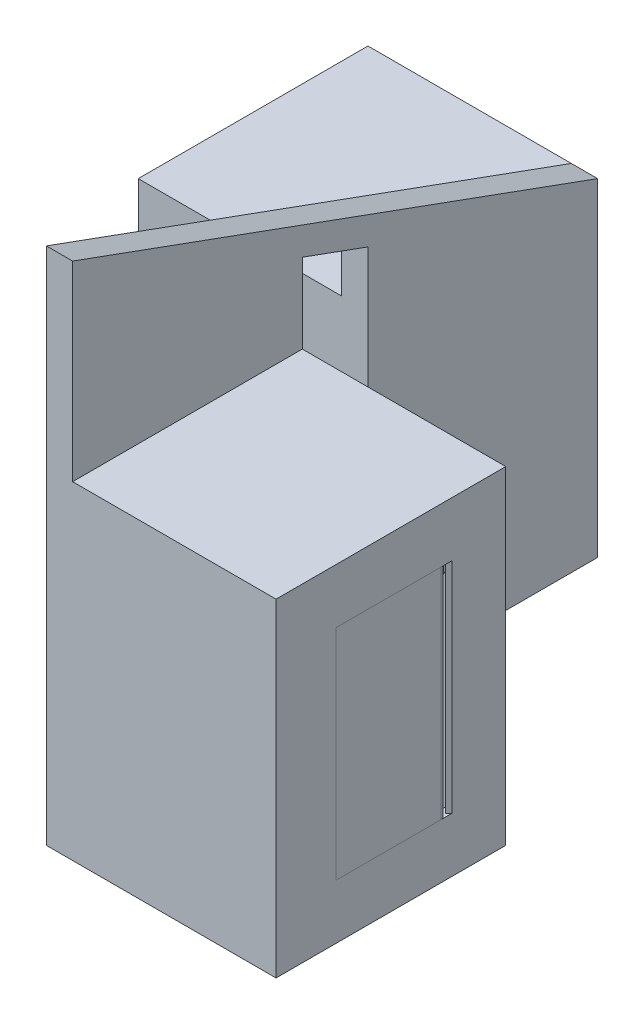
from build123d import *

# Parameters (mm, degrees)
SKETCH1_W              = 210
SKETCH1_H              = 300
SKETCH1_W_2            = 100
SKETCH1_H_2            = 200
BOSS_EXTRUDE1_DEPTH    = 12
BOSS_EXTRUDE2_START    = -12
SKETCH1_3_W            = 210
SKETCH1_3_H            = 300
SKETCH1_3_W_2          = 100
SKETCH1_3_H_2          = 200
BOSS_EXTRUDE2_DEPTH    = 210
BOSS_EXTRUDE3_START    = 12
SKETCH1_4_W            = 210
SKETCH1_4_H            = 300
SKETCH1_4_W_2          = 100
SKETCH1_4_H_2          = 200
BOSS_EXTRUDE3_DEPTH    = 210
SHELL1_START           = -190
SHELL1_OUTLINE_W       = 284
SHELL1_OUTLINE_H       = 194
SHELL1_DEPTH           = 194
SHELL1_START_2         = -4
SHELL1_2_OUTLINE_W     = 284
SHELL1_2_OUTLINE_H     = 194
SHELL1_2_DEPTH         = 194
SHELL1_3_DEPTH         = 8
CUT_EXTRUDE1_START     = 198
SKETCH1_5_W            = 100
SKETCH1_5_H            = 200
CUT_EXTRUDE1_DEPTH     = 8
CUT_EXTRUDE2_START     = -198
SKETCH1_6_W            = 100
SKETCH1_6_H            = 200
CUT_EXTRUDE2_DEPTH     = 8
CUT_EXTRUDE6_START     = 42
CUT_EXTRUDE6_DEPTH     = 200
BOSS_EXTRUDE4_START    = 42
BOSS_EXTRUDE4_DEPTH    = 200
BOSS_EXTRUDE5_START    = 42
BOSS_EXTRUDE5_DEPTH    = 8
BOSS_EXTRUDE6_START    = 42
SKETCH5_6_R            = 2
BOSS_EXTRUDE6_DEPTH    = 8
BOSS_EXTRUDE7_START    = 242
SKETCH5_7_R            = 2
BOSS_EXTRUDE7_DEPTH    = 8
INDENT1_START          = -330.731696712
INDENT1_OUTLINE_R      = 2
INDENT1_DEPTH          = 216
BOSS_EXTRUDE8_START    = 42
SKETCH6_R              = 2
BOSS_EXTRUDE8_DEPTH    = 8
BOSS_EXTRUDE9_START    = 42
SKETCH6_4_R            = 2
BOSS_EXTRUDE9_DEPTH    = 8
SKETCH7_W              = 2
SKETCH7_H              = 2
SKETCH7_H_2            = 8
SKETCH7_W_2            = 68.326220251
BOSS_EXTRUDE10_DEPTH   = 8
CUT_EXTRUDE7_DEPTH     = 4
BOSS_EXTRUDE11_START   = -4
BOSS_EXTRUDE11_DEPTH   = 46
SKETCH8_3_R            = 2
BOSS_EXTRUDE11_2_DEPTH = 46
BOSS_EXTRUDE12_DEPTH   = 8
BOSS_EXTRUDE13_DEPTH   = 8
SKETCH11_R             = 2
BOSS_EXTRUDE14_DEPTH   = 8
SKETCH14_W             = 4
SKETCH14_H             = 4
BOSS_EXTRUDE15_DEPTH   = 8
BOSS_EXTRUDE16_DEPTH   = 8
SKETCH13_W             = 4
SKETCH13_H             = 4
CUT_EXTRUDE8_DEPTH     = 12
SKETCH14_4_W           = 4
SKETCH14_4_H           = 4
BOSS_EXTRUDE17_DEPTH   = 12
CUT_EXTRUDE9_DEPTH     = 4
CUT_EXTRUDE10_DEPTH    = 100
SKETCH12_3_R           = 4
SKETCH12_3_R_2         = 2
BOSS_EXTRUDE18_DEPTH   = 100
SKETCH12_4_R           = 2
BOSS_EXTRUDE19_DEPTH   = 8
BOSS_EXTRUDE20_START   = 100
SKETCH12_5_R           = 2
BOSS_EXTRUDE20_DEPTH   = 8
BOSS_EXTRUDE21_DEPTH   = 8
BOSS_EXTRUDE22_DEPTH   = 8
BOSS_EXTRUDE23_DEPTH   = 8
BOSS_EXTRUDE24_START   = 8
BOSS_EXTRUDE24_DEPTH   = 8
CUT_EXTRUDE11_START    = 8
CUT_EXTRUDE11_DEPTH    = 8
BOSS_EXTRUDE25_START   = -4
BOSS_EXTRUDE25_DEPTH   = 28
INDENT2_START          = -223
INDENT2_OUTLINE_R      = 2
INDENT2_DEPTH          = 116
SKETCH19_W             = 30
SKETCH19_H             = 10
BOSS_EXTRUDE26_DEPTH   = 34


# Read off the part's stored shape, not the designer's step: Shell1, Indent1, Cut-Extrude10, Indent2
with BuildPart() as part:
    # Sketch1 → Boss-Extrude1 (new, symmetric)
    # profile 1 of 5: a face of its own
    with BuildSketch(Plane(origin=(0, 0, 0), x_dir=(0, 0, -1), z_dir=(1, 0, 0))):
        Polygon((270, -72.731696712), (-210, 101.974015735), (-210, -72.731696712), (0, -72.731696712), (0, 0), (60, -21.838214056), (60, -72.731696712), align=None)
    # profile 2 of 5: a face of its own
    with BuildSketch(Plane(origin=(0, 0, 0), x_dir=(0, 0, -1), z_dir=(1, 0, 0))):
        with Locations((-105, -222.731696712)):
            Rectangle(SKETCH1_W, SKETCH1_H)
        with Locations((-105, -222.731696712)):
            Rectangle(SKETCH1_W_2, SKETCH1_H_2, mode=Mode.SUBTRACT)
    # profile 3 of 5: a face of its own
    with BuildSketch(Plane(origin=(0, 0, 0), x_dir=(0, 0, -1), z_dir=(1, 0, 0))):
        with Locations((-105, -222.731696712)):
            Rectangle(SKETCH1_W_2, SKETCH1_H_2)
    # profile 4 of 5: a face of its own
    with BuildSketch(Plane(origin=(0, 0, 0), x_dir=(0, 0, -1), z_dir=(1, 0, 0))):
        with Locations((165, -222.731696712)):
            Rectangle(SKETCH1_W, SKETCH1_H)
        with Locations((165, -222.731696712)):
            Rectangle(SKETCH1_W_2, SKETCH1_H_2, mode=Mode.SUBTRACT)
    # profile 5 of 5: a face of its own
    with BuildSketch(Plane(origin=(0, 0, 0), x_dir=(0, 0, -1), z_dir=(1, 0, 0))):
        with Locations((165, -222.731696712)):
            Rectangle(SKETCH1_W_2, SKETCH1_H_2)
    extrude(amount=BOSS_EXTRUDE1_DEPTH, both=True)

    # Sketch1<3> → Boss-Extrude2 (add)
    # profile 1 of 2: a face of its own
    with BuildSketch(Plane(origin=(0, 0, 0), x_dir=(0, 0, -1), z_dir=(1, 0, 0)).offset(BOSS_EXTRUDE2_START)):
        with Locations((-105, -222.731696712)):
            Rectangle(SKETCH1_3_W, SKETCH1_3_H)
        with Locations((-105, -222.731696712)):
            Rectangle(SKETCH1_3_W_2, SKETCH1_3_H_2, mode=Mode.SUBTRACT)
    # profile 2 of 2: a face of its own
    with BuildSketch(Plane(origin=(0, 0, 0), x_dir=(0, 0, -1), z_dir=(1, 0, 0)).offset(BOSS_EXTRUDE2_START)):
        with Locations((-105, -222.731696712)):
            Rectangle(SKETCH1_3_W_2, SKETCH1_3_H_2)
    extrude(amount=BOSS_EXTRUDE2_DEPTH)

    # Sketch1<4> → Boss-Extrude3 (add)
    # profile 1 of 2: a face of its own
    with BuildSketch(Plane(origin=(0, 0, 0), x_dir=(0, 0, -1), z_dir=(1, 0, 0)).offset(BOSS_EXTRUDE3_START)):
        with Locations((165, -222.731696712)):
            Rectangle(SKETCH1_4_W, SKETCH1_4_H)
        with Locations((165, -222.731696712)):
            Rectangle(SKETCH1_4_W_2, SKETCH1_4_H_2, mode=Mode.SUBTRACT)
    # profile 2 of 2: a face of its own
    with BuildSketch(Plane(origin=(0, 0, 0), x_dir=(0, 0, -1), z_dir=(1, 0, 0)).offset(BOSS_EXTRUDE3_START)):
        with Locations((165, -222.731696712)):
            Rectangle(SKETCH1_4_W_2, SKETCH1_4_H_2)
    extrude(amount=-BOSS_EXTRUDE3_DEPTH)

    # Shell1 outline → Shell1 (cut)
    with BuildSketch(Plane.YZ.offset(SHELL1_START)):
        with Locations((-222.731696712, -165)):
            Rectangle(SHELL1_OUTLINE_W, SHELL1_OUTLINE_H)
    extrude(amount=SHELL1_DEPTH, mode=Mode.SUBTRACT)

    # Shell1 2 outline → Shell1 2 (cut)
    with BuildSketch(Plane.YZ.offset(SHELL1_START_2)):
        with Locations((-222.731696712, 105)):
            Rectangle(SHELL1_2_OUTLINE_W, SHELL1_2_OUTLINE_H)
    extrude(amount=SHELL1_2_DEPTH, mode=Mode.SUBTRACT)

    # Shell1 3 outline → Shell1 3 (cut)
    with BuildSketch(Plane.YZ.offset(SHELL1_START_2)):
        Polygon((90.548831681, 202), (-80.731696712, 202), (-80.731696712, 8), (11.425184054, 8), (-16.23655375, -68), (-80.731696712, -68), (-80.731696712, -262), (-78.333357018, -262), align=None)
    extrude(amount=SHELL1_3_DEPTH, mode=Mode.SUBTRACT)

    # Sketch1<5> → Cut-Extrude1 (cut)
    with BuildSketch(Plane(origin=(0, 0, 0), x_dir=(0, 0, -1), z_dir=(1, 0, 0)).offset(CUT_EXTRUDE1_START)):
        with Locations((-105, -222.731696712)):
            Rectangle(SKETCH1_5_W, SKETCH1_5_H)
    extrude(amount=-CUT_EXTRUDE1_DEPTH, mode=Mode.SUBTRACT)

    # Sketch1<6> → Cut-Extrude2 (cut)
    with BuildSketch(Plane(origin=(0, 0, 0), x_dir=(0, 0, -1), z_dir=(1, 0, 0)).offset(CUT_EXTRUDE2_START)):
        with Locations((165, -222.731696712)):
            Rectangle(SKETCH1_6_W, SKETCH1_6_H)
    extrude(amount=CUT_EXTRUDE2_DEPTH, mode=Mode.SUBTRACT)

    # Sketch5 → Cut-Extrude6 (cut)
    with BuildSketch(Plane.XZ.offset(80.731696712).offset(CUT_EXTRUDE6_START)):
        Polygon((261.882250994, -8.882250994), (198, 55), (196.522319509, 55), (195.171438948, 52.171706803), (259.053823869, -11.710678119), align=None)
        Polygon((192.343145751, 55), (190, 55), (190, 41.344439007), (195.171438948, 52.171706803), align=None)
        Polygon((194, 55), (192.343145751, 55), (195.171438948, 52.171706803), (196.522319509, 55), align=None)
    extrude(amount=CUT_EXTRUDE6_DEPTH, mode=Mode.SUBTRACT)

    # Indent1 outline → Indent1 (cut)
    with BuildSketch(Plane(origin=(0, 0, 0), x_dir=(1, 0, 0), z_dir=(0, 1, 0)).offset(INDENT1_START)):
        with Locations((194, -59)):
            Circle(INDENT1_OUTLINE_R)
    extrude(amount=INDENT1_DEPTH, mode=Mode.SUBTRACT)

    # Sketch8 → Cut-Extrude7 (cut)
    with BuildSketch(Plane.XZ.offset(80.731696712)):
        with BuildLine():
            ThreePointArc((116.073911699, 24.973088192), (116.008634179, 24.466285543), (115.817062773, 23.992565713))
            Line((115.817062773, 23.992565713), (160.817062773, 103.992565713))
            ThreePointArc((160.817062773, 103.992565713), (160.054434178, 106.716239267), (157.330760624, 105.953610672))
            Line((157.330760624, 105.953610672), (112.330760624, 25.953610672))
            ThreePointArc((112.330760624, 25.953610672), (114.580714348, 26.907810672), (116.073911699, 24.973088192))
        make_face()
        with BuildLine():
            ThreePointArc((112.330760624, 25.953610672), (113.093389219, 23.229937118), (115.817062773, 23.992565713))
            ThreePointArc((115.817062773, 23.992565713), (116.008634179, 24.466285543), (116.073911699, 24.973088192))
            ThreePointArc((116.073911699, 24.973088192), (114.580714348, 26.907810672), (112.330760624, 25.953610672))
        make_face()
        with BuildLine():
            ThreePointArc((84.58145395, 127.540956313), (83.546011614, 130.17303898), (80.913928946, 129.137596645))
            Line((80.913928946, 129.137596645), (35.913928946, 25.771408358))
            ThreePointArc((35.913928946, 25.771408358), (38.155413778, 26.93108781), (39.747691448, 24.973088192))
            ThreePointArc((39.747691448, 24.973088192), (39.705691065, 24.565365862), (39.58145395, 24.174768026))
            Line((39.58145395, 24.174768026), (84.58145395, 127.540956313))
        make_face()
        with BuildLine():
            ThreePointArc((39.747691448, 24.973088192), (38.155413778, 26.93108781), (35.913928946, 25.771408358))
            ThreePointArc((35.913928946, 25.771408358), (36.949371282, 23.139325691), (39.58145395, 24.174768026))
            ThreePointArc((39.58145395, 24.174768026), (39.705691065, 24.565365862), (39.747691448, 24.973088192))
        make_face()
    extrude(amount=-CUT_EXTRUDE7_DEPTH, mode=Mode.SUBTRACT)

    # Sketch13 → Cut-Extrude8 (cut)
    with BuildSketch(Plane.ZY.offset(4)):
        with BuildLine():
            Line((-232.412295169, -181.443240015), (-129.046106882, -181.443240015))
            ThreePointArc((-129.046106882, -181.443240015), (-127.046106882, -179.443240015), (-129.046106882, -177.443240015))
            Line((-129.046106882, -177.443240015), (-232.412295169, -177.443240015))
            ThreePointArc((-232.412295169, -177.443240015), (-234.412295169, -179.443240015), (-232.412295169, -181.443240015))
        make_face()
        with Locations((-232.412295169, -179.443240015)):
            Rectangle(SKETCH13_W, SKETCH13_H)
        with Locations((-129.046106882, -179.443240015)):
            Rectangle(SKETCH13_W, SKETCH13_H)
    extrude(amount=-CUT_EXTRUDE8_DEPTH, mode=Mode.SUBTRACT)

    # Sketch15 → Cut-Extrude9 (cut)
    with BuildSketch(Plane.ZY.offset(-4)):
        with BuildLine():
            Line((-233.555419875, -191.084357288), (-130.189231589, -263.084357288))
            ThreePointArc((-130.189231589, -263.084357288), (-127.404989609, -262.586364722), (-127.902982175, -259.802122742))
            Line((-127.902982175, -259.802122742), (-231.269170462, -187.802122742))
            ThreePointArc((-231.269170462, -187.802122742), (-234.053412442, -188.300115308), (-233.555419875, -191.084357288))
        make_face()
    extrude(amount=-CUT_EXTRUDE9_DEPTH, mode=Mode.SUBTRACT)

    # Cut-Extrude10 outline → Cut-Extrude10 (cut)
    with BuildSketch(Plane.XY.offset(-215)):
        Polygon((-190, -122.731696712), (-190, -106.622338744), (-195.404613209, -119.670229254), (-198, -117.074842463), (-198, -122.731696712), align=None)
    extrude(amount=CUT_EXTRUDE10_DEPTH, mode=Mode.SUBTRACT)

    # Indent2 outline → Indent2 (cut)
    with BuildSketch(Plane.XY.offset(INDENT2_START)):
        with Locations((-194, -126.731696712)):
            Circle(INDENT2_OUTLINE_R)
    extrude(amount=INDENT2_DEPTH, mode=Mode.SUBTRACT)

    # Sketch19 → Boss-Extrude26 (add)
    with BuildSketch(Plane.XZ.offset(80.731696712)):
        with Locations((95.073911699, 73.973088192)):
            Rectangle(SKETCH19_W, SKETCH19_H)
        with Locations((95.073911699, 55.973088192)):
            Rectangle(SKETCH19_W, SKETCH19_H)
    extrude(amount=BOSS_EXTRUDE26_DEPTH)


with BuildPart() as body_2:
    # Sketch5<4> → Boss-Extrude4 (new body)
    with BuildSketch(Plane.XZ.offset(80.731696712).offset(BOSS_EXTRUDE4_START)):
        with BuildLine():
            Line((190, 155), (190, 70.314845037))
            Line((190, 70.314845037), (192.666785717, 62.771278255))
            ThreePointArc((192.666785717, 62.771278255), (194.883831106, 62.901133499), (196.828427125, 61.828427125))
            Line((196.828427125, 61.828427125), (198, 60.656854249))
            Line((198, 60.656854249), (198, 155))
            Line((198, 155), (190, 155))
        make_face()
        with BuildLine():
            Line((192.666785717, 62.771278255), (190, 70.314845037))
            Line((190, 70.314845037), (190, 59.906230054))
            Line((190, 59.906230054), (190.390578712, 60.723971567))
            ThreePointArc((190.390578712, 60.723971567), (191.325064904, 61.974007773), (192.666785717, 62.771278255))
        make_face()
        with BuildLine():
            ThreePointArc((196.828427125, 61.828427125), (194.883831106, 62.901133499), (192.666785717, 62.771278255))
            Line((192.666785717, 62.771278255), (193.333392858, 60.885639127))
            ThreePointArc((193.333392858, 60.885639127), (195.154726313, 60.632974936), (196, 59))
            ThreePointArc((196, 59), (195.847759065, 58.234633135), (195.414213562, 57.585786438))
            Line((195.414213562, 57.585786438), (196.828427125, 56.171572875))
            ThreePointArc((196.828427125, 56.171572875), (197.265949872, 56.690547374), (197.609421288, 57.276028433))
            ThreePointArc((197.609421288, 57.276028433), (197.901133499, 58.116168894), (198, 59))
            ThreePointArc((198, 59), (197.69551813, 60.530733729), (196.828427125, 61.828427125))
        make_face()
        with BuildLine():
            Line((193.333392858, 60.885639127), (192.666785717, 62.771278255))
            ThreePointArc((192.666785717, 62.771278255), (191.325064904, 61.974007773), (190.390578712, 60.723971567))
            ThreePointArc((190.390578712, 60.723971567), (190.098866501, 59.883831106), (190, 59))
            ThreePointArc((190, 59), (190.30448187, 57.469266271), (191.171572875, 56.171572875))
            ThreePointArc((191.171572875, 56.171572875), (192.469266271, 55.30448187), (194, 55))
            ThreePointArc((194, 55), (195.530733729, 55.30448187), (196.828427125, 56.171572875))
            Line((196.828427125, 56.171572875), (195.414213562, 57.585786438))
            ThreePointArc((195.414213562, 57.585786438), (192.30825954, 57.933222508), (193.333392858, 60.885639127))
        make_face()
        with BuildLine():
            Line((198, 60.656854249), (196.828427125, 61.828427125))
            ThreePointArc((196.828427125, 61.828427125), (197.69551813, 60.530733729), (198, 59))
            Line((198, 59), (198, 60.656854249))
        make_face()
        with BuildLine():
            ThreePointArc((196, 59), (195.154726313, 60.632974936), (193.333392858, 60.885639127))
            Line((193.333392858, 60.885639127), (194, 59))
            Line((194, 59), (195.414213562, 57.585786438))
            ThreePointArc((195.414213562, 57.585786438), (195.847759065, 58.234633135), (196, 59))
        make_face()
        with BuildLine():
            Line((194, 59), (193.333392858, 60.885639127))
            ThreePointArc((193.333392858, 60.885639127), (192.30825954, 57.933222508), (195.414213562, 57.585786438))
            Line((195.414213562, 57.585786438), (194, 59))
        make_face()
        with BuildLine():
            Line((190.390578712, 60.723971567), (190, 59.906230054))
            Line((190, 59.906230054), (190, 59))
            ThreePointArc((190, 59), (190.098866501, 59.883831106), (190.390578712, 60.723971567))
        make_face()
    extrude(amount=BOSS_EXTRUDE4_DEPTH)

    # Sketch5<5> → Boss-Extrude5 (add)
    with BuildSketch(Plane.XZ.offset(80.731696712).offset(BOSS_EXTRUDE5_START)):
        with BuildLine():
            Line((183.601414115, 46.509725989), (169.374813886, 16.723971567))
            ThreePointArc((169.374813886, 16.723971567), (171.260263607, 11.390578712), (176.593656463, 13.276028433))
            Line((176.593656463, 13.276028433), (196.999966519, 56.000033481))
            Line((196.999966519, 56.000033481), (196.828427125, 56.171572875))
            ThreePointArc((196.828427125, 56.171572875), (195.530733729, 55.30448187), (194, 55))
            Line((194, 55), (192.343145751, 55))
            Line((192.343145751, 55), (191.171572875, 56.171572875))
            ThreePointArc((191.171572875, 56.171572875), (190.30448187, 57.469266271), (190, 59))
            Line((190, 59), (190, 59.906230054))
            Line((190, 59.906230054), (183.601414115, 46.509725989))
        make_face()
        with BuildLine():
            Line((171.17952453, 15.861985784), (175.942980804, 25.835073976))
            ThreePointArc((175.942980804, 25.835073976), (178.609677231, 26.777798836), (179.552402092, 24.111102409))
            Line((179.552402092, 24.111102409), (174.788945818, 14.138014216))
            ThreePointArc((174.788945818, 14.138014216), (172.122249391, 13.195289356), (171.17952453, 15.861985784))
        make_face(mode=Mode.SUBTRACT)
    extrude(amount=BOSS_EXTRUDE5_DEPTH)

    # Sketch5<6> → Boss-Extrude6 (add)
    with BuildSketch(Plane.XZ.offset(80.731696712).offset(BOSS_EXTRUDE6_START)):
        with Locations(Location((194, 59, 0), (0, 0, 90))):
            Circle(SKETCH5_6_R)
    extrude(amount=-BOSS_EXTRUDE6_DEPTH)

    # Sketch5<7> → Boss-Extrude7 (add)
    with BuildSketch(Plane.XZ.offset(80.731696712).offset(BOSS_EXTRUDE7_START)):
        with Locations(Location((194, 59, 0), (0, 0, 90))):
            Circle(SKETCH5_7_R)
    extrude(amount=BOSS_EXTRUDE7_DEPTH)


with BuildPart() as body_3:
    # Sketch6 → Boss-Extrude8 (new body)
    # profile 1 of 2: a face of its own
    with BuildSketch(Plane.XZ.offset(80.731696712).offset(BOSS_EXTRUDE8_START)):
        with BuildLine():
            Line((159.073911699, 28.973088192), (114.073911699, 28.973088192))
            ThreePointArc((114.073911699, 28.973088192), (110.073911699, 24.973088192), (114.073911699, 20.973088192))
            Line((114.073911699, 20.973088192), (159.073911699, 20.973088192))
            Line((159.073911699, 20.973088192), (177.747691448, 20.973088192))
            ThreePointArc((177.747691448, 20.973088192), (181.747691448, 24.973088192), (177.747691448, 28.973088192))
            Line((177.747691448, 28.973088192), (159.073911699, 28.973088192))
        make_face()
        with Locations((177.747691448, 24.973088192)):
            Circle(SKETCH6_R, mode=Mode.SUBTRACT)
        with BuildLine():
            ThreePointArc((114.073911699, 26.973088192), (112.073911699, 24.973088192), (114.073911699, 22.973088192))
            Line((114.073911699, 22.973088192), (159.073911699, 22.973088192))
            ThreePointArc((159.073911699, 22.973088192), (161.073911699, 24.973088192), (159.073911699, 26.973088192))
            Line((159.073911699, 26.973088192), (114.073911699, 26.973088192))
        make_face(mode=Mode.SUBTRACT)
    # profile 2 of 2: a face of its own
    with BuildSketch(Plane.XZ.offset(80.731696712).offset(BOSS_EXTRUDE8_START)):
        with Locations((177.747691448, 24.973088192)):
            Circle(SKETCH6_R)
    extrude(amount=-BOSS_EXTRUDE8_DEPTH)

    # Sketch6<4> → Boss-Extrude9 (add)
    with BuildSketch(Plane.XZ.offset(80.731696712).offset(BOSS_EXTRUDE9_START)):
        with Locations(Location((177.747691448, 24.973088192, 0), (0, 0, 90))):
            Circle(SKETCH6_4_R)
    extrude(amount=BOSS_EXTRUDE9_DEPTH)


with BuildPart() as body_4:
    # Sketch7 → Boss-Extrude10 (new body)
    with BuildSketch(Plane(origin=(0, -114.731696712, 0), x_dir=(1, 0, 0), z_dir=(0, 1, 0))):
        with BuildLine():
            Line((116.073911699, -28.973088192), (116.073911699, -61.508986577))
            ThreePointArc((116.073911699, -61.508986577), (117.538013314, -62.973088192), (118.073911699, -64.973088192))
            Line((118.073911699, -64.973088192), (118.073911699, -28.973088192))
            Line((118.073911699, -28.973088192), (116.073911699, -28.973088192))
        make_face()
        with BuildLine():
            Line((110.073911699, -24.973088192), (110.073911699, -60.973088192))
            Line((110.073911699, -60.973088192), (112.073911699, -60.973088192))
            Line((112.073911699, -60.973088192), (112.073911699, -28.437189807))
            ThreePointArc((112.073911699, -28.437189807), (110.609810083, -26.973088192), (110.073911699, -24.973088192))
        make_face()
        with BuildLine():
            ThreePointArc((114.073911699, -20.973088192), (111.245484574, -22.144661068), (110.073911699, -24.973088192))
            ThreePointArc((110.073911699, -24.973088192), (110.609810083, -26.973088192), (112.073911699, -28.437189807))
            Line((112.073911699, -28.437189807), (112.073911699, -24.973088192))
            ThreePointArc((112.073911699, -24.973088192), (112.659698136, -23.55887463), (114.073911699, -22.973088192))
            Line((114.073911699, -22.973088192), (117.538013314, -22.973088192))
            ThreePointArc((117.538013314, -22.973088192), (116.073911699, -21.508986577), (114.073911699, -20.973088192))
        make_face()
        with BuildLine():
            ThreePointArc((118.073911699, -24.973088192), (117.937615004, -23.937812012), (117.538013314, -22.973088192))
            Line((117.538013314, -22.973088192), (114.073911699, -22.973088192))
            ThreePointArc((114.073911699, -22.973088192), (115.488125261, -23.55887463), (116.073911699, -24.973088192))
            Line((116.073911699, -24.973088192), (116.073911699, -26.973088192))
            Line((116.073911699, -26.973088192), (118.073911699, -26.973088192))
            Line((118.073911699, -26.973088192), (118.073911699, -24.973088192))
        make_face()
        with Locations((117.073911699, -27.973088192)):
            Rectangle(SKETCH7_W, SKETCH7_H)
        with BuildLine():
            ThreePointArc((118.073911699, -64.973088192), (117.538013314, -62.973088192), (116.073911699, -61.508986577))
            Line((116.073911699, -61.508986577), (116.073911699, -68.437189807))
            ThreePointArc((116.073911699, -68.437189807), (117.538013314, -66.973088192), (118.073911699, -64.973088192))
        make_face()
        with Locations((111.073911699, -64.973088192)):
            Rectangle(SKETCH7_W, SKETCH7_H_2)
        with BuildLine():
            Line((112.073911699, -68.973088192), (110.073911699, -68.973088192))
            Line((110.073911699, -68.973088192), (110.073911699, -104.973088192))
            ThreePointArc((110.073911699, -104.973088192), (114.073911699, -108.973088192), (118.073911699, -104.973088192))
            Line((118.073911699, -104.973088192), (118.073911699, -64.973088192))
            ThreePointArc((118.073911699, -64.973088192), (117.538013314, -66.973088192), (116.073911699, -68.437189807))
            Line((116.073911699, -68.437189807), (116.073911699, -104.973088192))
            ThreePointArc((116.073911699, -104.973088192), (114.073911699, -106.973088192), (112.073911699, -104.973088192))
            Line((112.073911699, -104.973088192), (112.073911699, -68.973088192))
        make_face()
        with Locations((75.910801574, -64.973088192)):
            Rectangle(SKETCH7_W_2, SKETCH7_H_2)
        with Locations((40.747691448, -64.973088192)):
            Rectangle(SKETCH7_W, SKETCH7_H_2)
        with BuildLine():
            ThreePointArc((35.747691448, -68.437189807), (34.283589833, -66.973088192), (33.747691448, -64.973088192))
            Line((33.747691448, -64.973088192), (33.747691448, -128.339276479))
            ThreePointArc((33.747691448, -128.339276479), (37.747691448, -132.339276479), (41.747691448, -128.339276479))
            Line((41.747691448, -128.339276479), (41.747691448, -68.973088192))
            Line((41.747691448, -68.973088192), (39.747691448, -68.973088192))
            Line((39.747691448, -68.973088192), (39.747691448, -128.339276479))
            ThreePointArc((39.747691448, -128.339276479), (37.747691448, -130.339276479), (35.747691448, -128.339276479))
            Line((35.747691448, -128.339276479), (35.747691448, -68.437189807))
        make_face()
        with BuildLine():
            ThreePointArc((35.747691448, -61.508986577), (34.283589833, -62.973088192), (33.747691448, -64.973088192))
            ThreePointArc((33.747691448, -64.973088192), (34.283589833, -66.973088192), (35.747691448, -68.437189807))
            Line((35.747691448, -68.437189807), (35.747691448, -61.508986577))
        make_face()
        with BuildLine():
            ThreePointArc((41.747691448, -24.973088192), (37.747691448, -20.973088192), (33.747691448, -24.973088192))
            Line((33.747691448, -24.973088192), (33.747691448, -64.973088192))
            ThreePointArc((33.747691448, -64.973088192), (34.283589833, -62.973088192), (35.747691448, -61.508986577))
            Line((35.747691448, -61.508986577), (35.747691448, -24.973088192))
            ThreePointArc((35.747691448, -24.973088192), (37.747691448, -22.973088192), (39.747691448, -24.973088192))
            Line((39.747691448, -24.973088192), (39.747691448, -60.973088192))
            Line((39.747691448, -60.973088192), (41.747691448, -60.973088192))
            Line((41.747691448, -60.973088192), (41.747691448, -24.973088192))
        make_face()
    extrude(amount=BOSS_EXTRUDE10_DEPTH)


with BuildPart() as body_5:
    # Sketch8<3> → Boss-Extrude11 (new body)
    with BuildSketch(Plane.XZ.offset(80.731696712).offset(BOSS_EXTRUDE11_START)):
        with BuildLine():
            ThreePointArc((39.747691448, 24.973088192), (38.155413778, 26.93108781), (35.913928946, 25.771408358))
            ThreePointArc((35.913928946, 25.771408358), (36.949371282, 23.139325691), (39.58145395, 24.174768026))
            ThreePointArc((39.58145395, 24.174768026), (39.705691065, 24.565365862), (39.747691448, 24.973088192))
        make_face()
    extrude(amount=BOSS_EXTRUDE11_DEPTH)


with BuildPart() as body_6:
    # Sketch8<3> → Boss-Extrude11 2 (new body)
    with BuildSketch(Plane.XZ.offset(80.731696712).offset(BOSS_EXTRUDE11_START)):
        with Locations(Location((114.073911699, 24.973088192, 0), (0, 0, 90))):
            Circle(SKETCH8_3_R)
    extrude(amount=BOSS_EXTRUDE11_2_DEPTH)


with BuildPart() as body_7:
    # Sketch9 → Boss-Extrude12 (new body)
    with BuildSketch(Plane.XZ.offset(114.731696712)):
        with BuildLine():
            Line((4, 20.973088192), (37.747691448, 20.973088192))
            Line((37.747691448, 20.973088192), (82.747691448, 20.973088192))
            ThreePointArc((82.747691448, 20.973088192), (86.747691448, 24.973088192), (82.747691448, 28.973088192))
            Line((82.747691448, 28.973088192), (37.747691448, 28.973088192))
            Line((37.747691448, 28.973088192), (4, 28.973088192))
            Line((4, 28.973088192), (4, 20.973088192))
        make_face()
        with BuildLine():
            Line((82.747691448, 22.973088192), (37.747691448, 22.973088192))
            ThreePointArc((37.747691448, 22.973088192), (35.747691448, 24.973088192), (37.747691448, 26.973088192))
            Line((37.747691448, 26.973088192), (82.747691448, 26.973088192))
            ThreePointArc((82.747691448, 26.973088192), (84.747691448, 24.973088192), (82.747691448, 22.973088192))
        make_face(mode=Mode.SUBTRACT)
    extrude(amount=BOSS_EXTRUDE12_DEPTH)

    # Sketch11 → Boss-Extrude14 (add)
    with BuildSketch(Plane.ZY.offset(-4)):
        with Locations((24.973088192, -118.731696712)):
            Circle(SKETCH11_R)
    extrude(amount=BOSS_EXTRUDE14_DEPTH)


with BuildPart() as body_8:
    # Sketch10 → Boss-Extrude13 (new body)
    with BuildSketch(Plane.ZY.offset(-4)):
        with BuildLine():
            Line((20.973088192, 16.147002002), (20.973088192, -156.353912478))
            ThreePointArc((20.973088192, -156.353912478), (24.973088192, -160.353912478), (28.973088192, -156.353912478))
            Line((28.973088192, -156.353912478), (28.973088192, 21.859594029))
            ThreePointArc((28.973088192, 21.859594029), (28.912319204, 22.55418674), (28.731858675, 23.227674603))
            ThreePointArc((28.731858675, 23.227674603), (26.663561239, 25.484825178), (23.605007619, 25.618364513))
            Line((23.605007619, 25.618364513), (-236.412295169, -69.020194096))
            Line((-236.412295169, -69.020194096), (-236.412295169, -169.443240015))
            ThreePointArc((-236.412295169, -169.443240015), (-232.412295169, -173.443240015), (-228.412295169, -169.443240015))
            Line((-228.412295169, -169.443240015), (-228.412295169, -74.621854402))
            Line((-228.412295169, -74.621854402), (20.973088192, 16.147002002))
        make_face()
        with BuildLine():
            ThreePointArc((26.973088192, -156.353912478), (24.973088192, -158.353912478), (22.973088192, -156.353912478))
            Line((22.973088192, -156.353912478), (22.973088192, -118.731696712))
            ThreePointArc((22.973088192, -118.731696712), (24.973088192, -116.731696712), (26.973088192, -118.731696712))
            Line((26.973088192, -118.731696712), (26.973088192, -156.353912478))
        make_face(mode=Mode.SUBTRACT)
        with BuildLine():
            ThreePointArc((-230.412295169, -169.443240015), (-232.412295169, -171.443240015), (-234.412295169, -169.443240015))
            Line((-234.412295169, -169.443240015), (-234.412295169, -131.821024249))
            ThreePointArc((-234.412295169, -131.821024249), (-232.412295169, -129.821024249), (-230.412295169, -131.821024249))
            Line((-230.412295169, -131.821024249), (-230.412295169, -169.443240015))
        make_face(mode=Mode.SUBTRACT)
    extrude(amount=BOSS_EXTRUDE13_DEPTH)


with BuildPart() as body_9:
    # Sketch14 → Boss-Extrude15 (new body)
    # profile 1 of 5: a face of its own
    with BuildSketch(Plane.ZY.offset(4)):
        with BuildLine():
            ThreePointArc((-228.412295169, -169.443240015), (-232.412295169, -173.443240015), (-236.412295169, -169.443240015))
            Line((-236.412295169, -169.443240015), (-236.412295169, -189.443240015))
            Line((-236.412295169, -189.443240015), (-236.412295169, -261.443240015))
            ThreePointArc((-236.412295169, -261.443240015), (-232.412295169, -265.443240015), (-228.412295169, -261.443240015))
            Line((-228.412295169, -261.443240015), (-228.412295169, -189.443240015))
            Line((-228.412295169, -189.443240015), (-228.412295169, -169.443240015))
        make_face()
        with BuildLine():
            Line((-234.412295169, -261.443240015), (-234.412295169, -189.443240015))
            ThreePointArc((-234.412295169, -189.443240015), (-232.412295169, -187.443240015), (-230.412295169, -189.443240015))
            Line((-230.412295169, -189.443240015), (-230.412295169, -261.443240015))
            ThreePointArc((-230.412295169, -261.443240015), (-232.412295169, -263.443240015), (-234.412295169, -261.443240015))
        make_face(mode=Mode.SUBTRACT)
        with Locations((-232.412295169, -179.443240015)):
            Rectangle(SKETCH14_W, SKETCH14_H, mode=Mode.SUBTRACT)
    # profile 2 of 5: a face of its own
    with BuildSketch(Plane.ZY.offset(4)):
        with Locations((-232.412295169, -179.443240015)):
            Rectangle(SKETCH14_W, SKETCH14_H)
    # profile 3 of 5: a face of its own
    with BuildSketch(Plane.ZY.offset(4)):
        with BuildLine():
            ThreePointArc((-228.412295169, -131.821024249), (-232.412295169, -127.821024249), (-236.412295169, -131.821024249))
            Line((-236.412295169, -131.821024249), (-236.412295169, -169.443240015))
            ThreePointArc((-236.412295169, -169.443240015), (-232.412295169, -173.443240015), (-228.412295169, -169.443240015))
            Line((-228.412295169, -169.443240015), (-228.412295169, -131.821024249))
        make_face()
        with BuildLine():
            ThreePointArc((-234.412295169, -131.821024249), (-232.412295169, -129.821024249), (-230.412295169, -131.821024249))
            Line((-230.412295169, -131.821024249), (-230.412295169, -169.443240015))
            ThreePointArc((-230.412295169, -169.443240015), (-232.412295169, -171.443240015), (-234.412295169, -169.443240015))
            Line((-234.412295169, -169.443240015), (-234.412295169, -131.821024249))
        make_face(mode=Mode.SUBTRACT)
    # profile 4 of 5: a face of its own
    with BuildSketch(Plane.ZY.offset(4)):
        with BuildLine():
            Line((-230.412295169, -169.443240015), (-230.412295169, -131.821024249))
            ThreePointArc((-230.412295169, -131.821024249), (-232.412295169, -133.821024249), (-234.412295169, -131.821024249))
            Line((-234.412295169, -131.821024249), (-234.412295169, -169.443240015))
            ThreePointArc((-234.412295169, -169.443240015), (-232.412295169, -171.443240015), (-230.412295169, -169.443240015))
        make_face()
    # profile 5 of 5: a face of its own
    with BuildSketch(Plane.ZY.offset(4)):
        with BuildLine():
            ThreePointArc((-234.412295169, -131.821024249), (-232.412295169, -133.821024249), (-230.412295169, -131.821024249))
            ThreePointArc((-230.412295169, -131.821024249), (-232.412295169, -129.821024249), (-234.412295169, -131.821024249))
        make_face()
    extrude(amount=BOSS_EXTRUDE15_DEPTH)

    # Sketch14<3> → Boss-Extrude16 (add)
    with BuildSketch(Plane.ZY.offset(4)):
        with BuildLine():
            ThreePointArc((-234.412295169, -131.821024249), (-232.412295169, -133.821024249), (-230.412295169, -131.821024249))
            ThreePointArc((-230.412295169, -131.821024249), (-232.412295169, -129.821024249), (-234.412295169, -131.821024249))
        make_face()
    extrude(amount=-BOSS_EXTRUDE16_DEPTH)

    # Sketch14<4> → Boss-Extrude17 (add)
    with BuildSketch(Plane.ZY.offset(4)):
        with Locations((-232.412295169, -179.443240015)):
            Rectangle(SKETCH14_4_W, SKETCH14_4_H)
    extrude(amount=-BOSS_EXTRUDE17_DEPTH)


with BuildPart() as body_10:
    # Sketch12<3> → Boss-Extrude18 (new body)
    # profile 1 of 5: a face of its own
    with BuildSketch(Plane.XY.offset(-215)):
        with BuildLine():
            Line((-196.828427125, -129.560123837), (-198, -128.388550962))
            Line((-198, -128.388550962), (-198, -322.731696712))
            Line((-198, -322.731696712), (-190, -322.731696712))
            Line((-190, -322.731696712), (-190, -127.527346182))
            Line((-190, -127.527346182), (-190.30448187, -128.262430442))
            ThreePointArc((-190.30448187, -128.262430442), (-193.219638712, -130.654837834), (-196.828427125, -129.560123837))
        make_face()
    # profile 2 of 5: a face of its own
    with BuildSketch(Plane.XY.offset(-215)):
        with Locations((-194, -126.731696712)):
            Circle(SKETCH12_3_R)
        with Locations((-194, -126.731696712)):
            Circle(SKETCH12_3_R_2, mode=Mode.SUBTRACT)
    # profile 3 of 5: a face of its own
    with BuildSketch(Plane.XY.offset(-215)):
        with Locations((-194, -126.731696712)):
            Circle(SKETCH12_3_R_2)
    # profile 4 of 5: a face of its own
    with BuildSketch(Plane.XY.offset(-215)):
        with BuildLine():
            Line((-198, -126.731696712), (-198, -128.388550962))
            Line((-198, -128.388550962), (-196.828427125, -129.560123837))
            ThreePointArc((-196.828427125, -129.560123837), (-197.69551813, -128.262430442), (-198, -126.731696712))
        make_face()
    # profile 5 of 5: a face of its own
    with BuildSketch(Plane.XY.offset(-215)):
        with BuildLine():
            ThreePointArc((-190, -126.731696712), (-190.076858878, -127.512058001), (-190.30448187, -128.262430442))
            Line((-190.30448187, -128.262430442), (-190, -127.527346182))
            Line((-190, -127.527346182), (-190, -126.731696712))
        make_face()
    extrude(amount=BOSS_EXTRUDE18_DEPTH)

    # Sketch12<4> → Boss-Extrude19 (add)
    with BuildSketch(Plane.XY.offset(-215)):
        with Locations((-194, -126.731696712)):
            Circle(SKETCH12_4_R)
    extrude(amount=-BOSS_EXTRUDE19_DEPTH)

    # Sketch12<5> → Boss-Extrude20 (add)
    with BuildSketch(Plane.XY.offset(-215).offset(BOSS_EXTRUDE20_START)):
        with Locations((-194, -126.731696712)):
            Circle(SKETCH12_5_R)
    extrude(amount=BOSS_EXTRUDE20_DEPTH)

    # Sketch12<6> → Boss-Extrude21 (add)
    with BuildSketch(Plane.XY.offset(-215)):
        with BuildLine():
            Line((-184.807164816, -114.990733055), (-175.392793625, -92.262430442))
            ThreePointArc((-175.392793625, -92.262430442), (-177.557578025, -87.036178582), (-182.783829885, -89.200962983))
            Line((-182.783829885, -89.200962983), (-197.69551813, -125.200962983))
            ThreePointArc((-197.69551813, -125.200962983), (-193.219638712, -122.808555591), (-190, -126.731696712))
            Line((-190, -126.731696712), (-190, -127.527346182))
            Line((-190, -127.527346182), (-184.807164816, -114.990733055))
        make_face()
        with BuildLine():
            ThreePointArc((-186.445784895, -113.720460012), (-186.472502861, -113.782020785), (-186.501271128, -113.842650524))
            ThreePointArc((-186.501271128, -113.842650524), (-189.120471597, -114.776134246), (-190.141303025, -112.189726283))
            Line((-190.141303025, -112.189726283), (-180.93607082, -89.966329848))
            ThreePointArc((-180.93607082, -89.966329848), (-178.32294489, -88.883937647), (-177.24055269, -91.497063577))
            Line((-177.24055269, -91.497063577), (-186.445784895, -113.720460012))
        make_face(mode=Mode.SUBTRACT)
    extrude(amount=BOSS_EXTRUDE21_DEPTH)


with BuildPart() as body_11:
    # Sketch17 → Boss-Extrude22 (new body)
    with BuildSketch(Plane.XY.offset(-207)):
        with BuildLine():
            Line((-175.088311755, -185.443240015), (-175.088311755, -90.731696712))
            ThreePointArc((-175.088311755, -90.731696712), (-175.165170633, -91.512058001), (-175.392793625, -92.262430442))
            Line((-175.392793625, -92.262430442), (-183.088311755, -110.841054681))
            Line((-183.088311755, -110.841054681), (-183.088311755, -193.443240015))
            Line((-183.088311755, -193.443240015), (-12, -193.443240015))
            Line((-12, -193.443240015), (-12, -189.443240015))
            Line((-12, -189.443240015), (-12, -185.443240015))
            Line((-12, -185.443240015), (-175.088311755, -185.443240015))
        make_face()
        with BuildLine():
            ThreePointArc((-182.783829885, -89.200962983), (-183.011452876, -89.951335424), (-183.088311755, -90.731696712))
            Line((-183.088311755, -90.731696712), (-183.088311755, -95.162299102))
            Line((-183.088311755, -95.162299102), (-180.93607082, -89.966329848))
            ThreePointArc((-180.93607082, -89.966329848), (-178.698131111, -88.770126152), (-177.088311755, -90.731696712))
            ThreePointArc((-177.088311755, -90.731696712), (-177.126741194, -91.121877356), (-177.24055269, -91.497063577))
            Line((-177.24055269, -91.497063577), (-183.088311755, -105.614802821))
            Line((-183.088311755, -105.614802821), (-183.088311755, -110.841054681))
            Line((-183.088311755, -110.841054681), (-175.392793625, -92.262430442))
            ThreePointArc((-175.392793625, -92.262430442), (-175.165170633, -91.512058001), (-175.088311755, -90.731696712))
            ThreePointArc((-175.088311755, -90.731696712), (-178.307950467, -86.808555591), (-182.783829885, -89.200962983))
        make_face()
        with BuildLine():
            Line((-180.93607082, -89.966329848), (-183.088311755, -95.162299102))
            Line((-183.088311755, -95.162299102), (-183.088311755, -105.614802821))
            Line((-183.088311755, -105.614802821), (-177.24055269, -91.497063577))
            ThreePointArc((-177.24055269, -91.497063577), (-179.853678619, -92.579455777), (-180.93607082, -89.966329848))
        make_face()
        with BuildLine():
            ThreePointArc((-177.088311755, -90.731696712), (-178.698131111, -88.770126152), (-180.93607082, -89.966329848))
            ThreePointArc((-180.93607082, -89.966329848), (-179.853678619, -92.579455777), (-177.24055269, -91.497063577))
            ThreePointArc((-177.24055269, -91.497063577), (-177.126741194, -91.121877356), (-177.088311755, -90.731696712))
        make_face()
    extrude(amount=BOSS_EXTRUDE22_DEPTH)

    # Sketch17<3> → Boss-Extrude23 (add)
    with BuildSketch(Plane.XY.offset(-207)):
        with BuildLine():
            ThreePointArc((-177.24055269, -91.497063577), (-177.126741194, -91.121877356), (-177.088311755, -90.731696712))
            ThreePointArc((-177.088311755, -90.731696712), (-178.698131111, -88.770126152), (-180.93607082, -89.966329848))
            ThreePointArc((-180.93607082, -89.966329848), (-179.853678619, -92.579455777), (-177.24055269, -91.497063577))
        make_face()
    extrude(amount=-BOSS_EXTRUDE23_DEPTH)

    # Sketch18 → Boss-Extrude24 (add)
    with BuildSketch(Plane.ZY.offset(12).offset(BOSS_EXTRUDE24_START)):
        with BuildLine():
            Line((-129.046106882, -185.443240015), (-232.412295169, -185.443240015))
            ThreePointArc((-232.412295169, -185.443240015), (-236.412295169, -189.443240015), (-232.412295169, -193.443240015))
            Line((-232.412295169, -193.443240015), (-129.046106882, -193.443240015))
            ThreePointArc((-129.046106882, -193.443240015), (-125.046106882, -189.443240015), (-129.046106882, -185.443240015))
        make_face()
        with BuildLine():
            Line((-129.046106882, -187.443240015), (-232.412295169, -187.443240015))
            ThreePointArc((-232.412295169, -187.443240015), (-234.412295169, -189.443240015), (-232.412295169, -191.443240015))
            Line((-232.412295169, -191.443240015), (-129.046106882, -191.443240015))
            ThreePointArc((-129.046106882, -191.443240015), (-127.046106882, -189.443240015), (-129.046106882, -187.443240015))
        make_face(mode=Mode.SUBTRACT)
    extrude(amount=-BOSS_EXTRUDE24_DEPTH)

    # Sketch18<2> → Cut-Extrude11 (cut)
    with BuildSketch(Plane.ZY.offset(12).offset(CUT_EXTRUDE11_START)):
        with BuildLine():
            Line((-129.046106882, -187.443240015), (-232.412295169, -187.443240015))
            ThreePointArc((-232.412295169, -187.443240015), (-234.412295169, -189.443240015), (-232.412295169, -191.443240015))
            Line((-232.412295169, -191.443240015), (-129.046106882, -191.443240015))
            ThreePointArc((-129.046106882, -191.443240015), (-127.046106882, -189.443240015), (-129.046106882, -187.443240015))
        make_face()
    extrude(amount=-CUT_EXTRUDE11_DEPTH, mode=Mode.SUBTRACT)


with BuildPart() as body_12:
    # Sketch15<3> → Boss-Extrude25 (new body)
    with BuildSketch(Plane.ZY.offset(-4).offset(BOSS_EXTRUDE25_START)):
        with BuildLine():
            ThreePointArc((-231.269170462, -187.802122742), (-234.053412442, -188.300115308), (-233.555419875, -191.084357288))
            ThreePointArc((-233.555419875, -191.084357288), (-231.486619581, -191.216125997), (-230.412295169, -189.443240015))
            ThreePointArc((-230.412295169, -189.443240015), (-230.639409186, -188.517564428), (-231.269170462, -187.802122742))
        make_face()
    extrude(amount=BOSS_EXTRUDE25_DEPTH)


solid = Compound([part.part, body_2.part, body_3.part, body_4.part, body_5.part, body_6.part, body_7.part, body_8.part, body_9.part, body_10.part, body_11.part, body_12.part])
